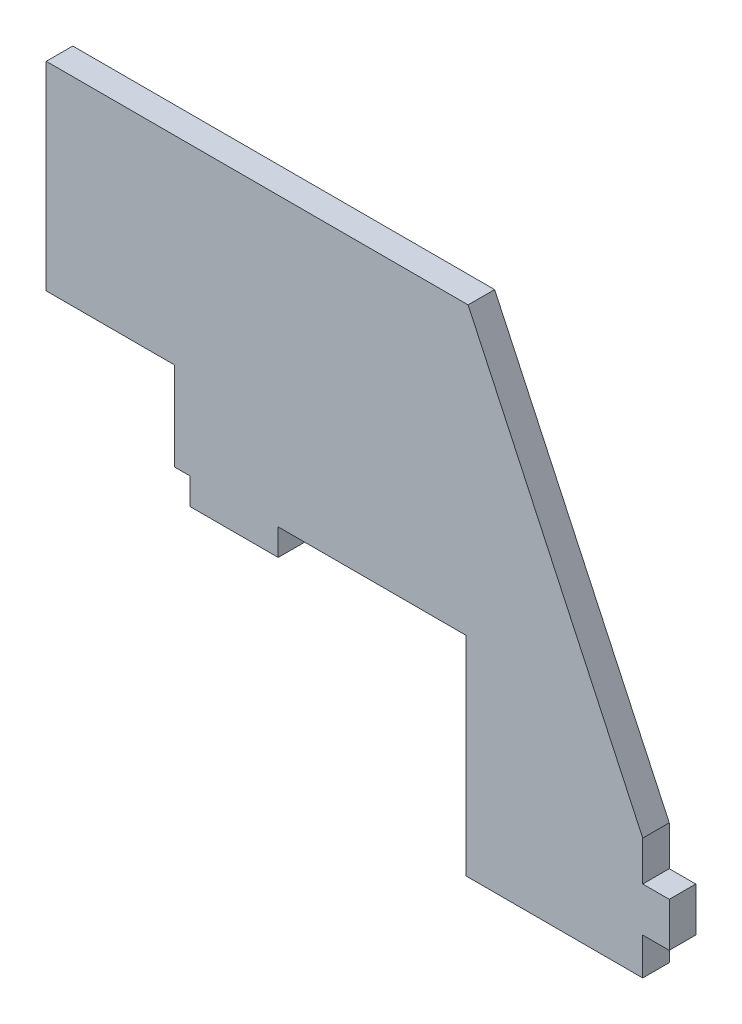
from build123d import *

# Parameters (mm, degrees)
ESQUISSE1_W             = 135
ESQUISSE1_H             = 112.17
BOSS_EXTRU_1_DEPTH      = 6
ENL_V_MAT_EXTRU_1_DEPTH = 6
ESQUISSE3_W             = 6
ESQUISSE3_H             = 10
ESQUISSE3_W_2           = 20
ESQUISSE3_H_2           = 6
BOSS_EXTRU_2_DEPTH      = 6


with BuildPart() as part:
    # Esquisse1 → Boss.-Extru.1 (new body)
    with BuildSketch(Plane.XY):
        Rectangle(ESQUISSE1_W, ESQUISSE1_H)
    extrude(amount=BOSS_EXTRU_1_DEPTH)

    # Esquisse2 → Enlèv. mat.-Extru.1 (cut)
    with BuildSketch(Plane.XY.offset(6)):
        Polygon((27.5, -56.085), (-67.5, -56.085), (-67.5, -8.915), (-67.5, 11.085), (-38.5, 11.085), (-38.5, -8.915), (27.5, -8.915), align=None)
        Polygon((67.5, -28.665), (27.980425971, 56.085), (67.5, 56.085), align=None)
    extrude(amount=-ENL_V_MAT_EXTRU_1_DEPTH, mode=Mode.SUBTRACT)

    # Esquisse3 → Boss.-Extru.2 (add)
    with BuildSketch(Plane.XY.offset(6)):
        with Locations((70.5, -42.665)):
            Rectangle(ESQUISSE3_W, ESQUISSE3_H)
        with Locations((-25, -11.915)):
            Rectangle(ESQUISSE3_W_2, ESQUISSE3_H_2)
    extrude(amount=-BOSS_EXTRU_2_DEPTH)


solid = part.part
